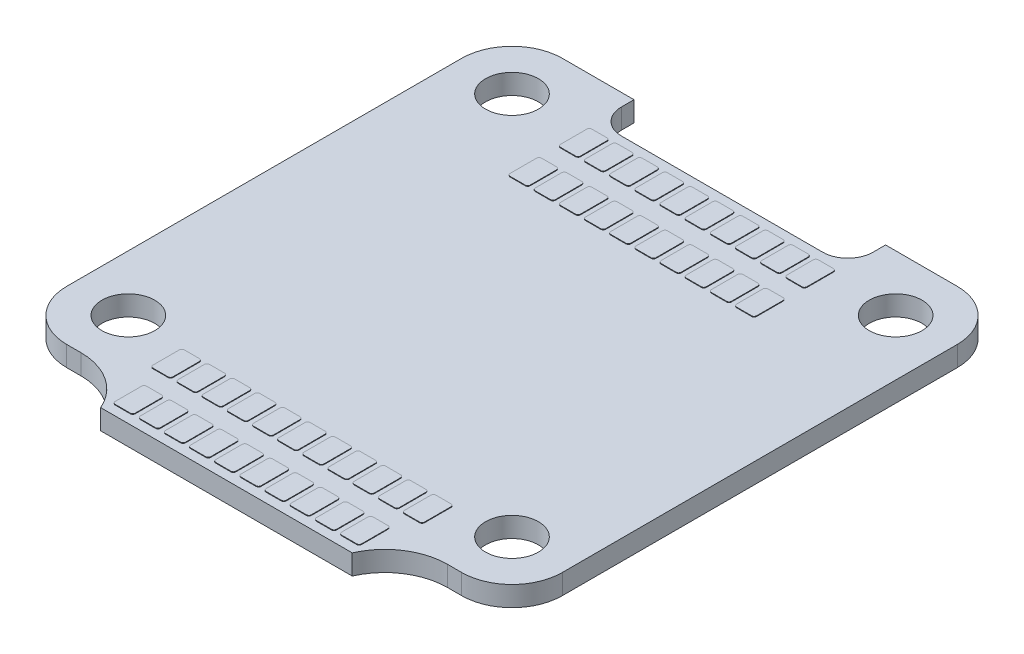
from build123d import *

# Parameters (mm, degrees)
SKETCH1_R           = 2.1
SKETCH1_W           = 20
SKETCH1_H           = 3
BOSS_EXTRUDE1_DEPTH = 0.8
FILLET1_R           = 5
SKETCH2_W           = 1.6
SKETCH2_H           = 2.5
BOSS_EXTRUDE2_DEPTH = 0.05
FILLET2_R           = 0.2


with BuildPart() as part:
    # Sketch1 → Boss-Extrude1 (new, symmetric)
    # profile 1 of 2: a face of its own
    with BuildSketch(Plane(origin=(0, 0, 0), x_dir=(1, 0, 0), z_dir=(0, 1, 0))):
        with BuildLine():
            Line((-10, 18.7), (-10, 19.7))
            Line((-10, 19.7), (-15.7, 19.7))
            ThreePointArc((-15.7, 19.7), (-18.528427125, 18.528427125), (-19.7, 15.7))
            Line((-19.7, 15.7), (-19.7, -15.7))
            ThreePointArc((-19.7, -15.7), (-18.528427125, -18.528427125), (-15.7, -19.7))
            Line((-15.7, -19.7), (-10, -19.7))
            Line((-10, -19.7), (10, -19.7))
            Line((10, -19.7), (15.7, -19.7))
            ThreePointArc((15.7, -19.7), (18.528427125, -18.528427125), (19.7, -15.7))
            Line((19.7, -15.7), (19.7, 15.7))
            ThreePointArc((19.7, 15.7), (18.528427125, 18.528427125), (15.7, 19.7))
            Line((15.7, 19.7), (10, 19.7))
            Line((10, 19.7), (10, 18.7))
            ThreePointArc((10, 18.7), (9.414213562, 17.285786438), (8, 16.7))
            Line((8, 16.7), (-8, 16.7))
            ThreePointArc((-8, 16.7), (-9.414213562, 17.285786438), (-10, 18.7))
        make_face()
        with Locations(Location((-15.25, -15.25, 0), (0, 0, 270))):
            Circle(SKETCH1_R, mode=Mode.SUBTRACT)
        with Locations(Location((15.25, -15.25, 0), (0, 0, 270))):
            Circle(SKETCH1_R, mode=Mode.SUBTRACT)
        with Locations(Location((-15.25, 15.25, 0), (0, 0, 270))):
            Circle(SKETCH1_R, mode=Mode.SUBTRACT)
        with Locations(Location((15.25, 15.25, 0), (0, 0, 270))):
            Circle(SKETCH1_R, mode=Mode.SUBTRACT)
    # profile 2 of 2: a face of its own
    with BuildSketch(Plane(origin=(0, 0, 0), x_dir=(1, 0, 0), z_dir=(0, 1, 0))):
        with Locations((0, -21.2)):
            Rectangle(SKETCH1_W, SKETCH1_H)
    extrude(amount=BOSS_EXTRUDE1_DEPTH, both=True)

    # Fillet1
    # the kernel refuses this fillet: 5 mm, written as the material it adds along each edge
    with BuildSketch(Plane(origin=(-10, -0.8, 19.7), x_dir=(-1, 0, 0), z_dir=(0, 1, 0)), Plane(origin=(10, 0.8, 19.7), x_dir=(1, 0, 0), z_dir=(0, -1, 0))) as fillet1_piece_1:
        with BuildLine():
            CenterArc((4.582575695, 5), FILLET1_R, 203.578178478, 66.421821522)
            Line((0, 3), (-0.091651514, 2.96))
            ThreePointArc((-0.091651514, 2.96), (-0.1, 1.5), (-0.1, 0))
            Line((-0.1, 0), (0, -0.1))
            Line((0, -0.1), (4.582575695, -0.1))
            Line((4.582575695, -0.1), (4.582575695, 0))
        make_face()
    extrude(amount=1.6)

    # Sketch2 → Boss-Extrude2 (add, symmetric)
    with BuildSketch(Plane(origin=(0, 0.8, 0), x_dir=(1, 0, 0), z_dir=(0, 1, 0))):
        with Locations((-3, -20.7)):
            Rectangle(SKETCH2_W, SKETCH2_H)
        with Locations((0, -16.7)):
            Rectangle(SKETCH2_W, SKETCH2_H)
        with Locations((-1, -20.7)):
            Rectangle(SKETCH2_W, SKETCH2_H)
        with Locations((-5, -20.7)):
            Rectangle(SKETCH2_W, SKETCH2_H)
        with Locations((-7, -20.7)):
            Rectangle(SKETCH2_W, SKETCH2_H)
        with Locations((-9, -20.7)):
            Rectangle(SKETCH2_W, SKETCH2_H)
        with Locations((-2, -16.7)):
            Rectangle(SKETCH2_W, SKETCH2_H)
        with Locations((-4, -16.7)):
            Rectangle(SKETCH2_W, SKETCH2_H)
        with Locations((-6, -16.7)):
            Rectangle(SKETCH2_W, SKETCH2_H)
        with Locations((-8, -16.7)):
            Rectangle(SKETCH2_W, SKETCH2_H)
        with Locations((-10, -16.7)):
            Rectangle(SKETCH2_W, SKETCH2_H)
        with Locations((1, -20.7)):
            Rectangle(SKETCH2_W, SKETCH2_H)
        with Locations((10, -16.7)):
            Rectangle(SKETCH2_W, SKETCH2_H)
        with Locations((8, -16.7)):
            Rectangle(SKETCH2_W, SKETCH2_H)
        with Locations((6, -16.7)):
            Rectangle(SKETCH2_W, SKETCH2_H)
        with Locations((4, -16.7)):
            Rectangle(SKETCH2_W, SKETCH2_H)
        with Locations((2, -16.7)):
            Rectangle(SKETCH2_W, SKETCH2_H)
        with Locations((9, -20.7)):
            Rectangle(SKETCH2_W, SKETCH2_H)
        with Locations((7, -20.7)):
            Rectangle(SKETCH2_W, SKETCH2_H)
        with Locations((5, -20.7)):
            Rectangle(SKETCH2_W, SKETCH2_H)
        with Locations((3, -20.7)):
            Rectangle(SKETCH2_W, SKETCH2_H)
        with Locations((3, 14.7)):
            Rectangle(SKETCH2_W, SKETCH2_H)
        with Locations((1, 14.7)):
            Rectangle(SKETCH2_W, SKETCH2_H)
        with Locations((5, 14.7)):
            Rectangle(SKETCH2_W, SKETCH2_H)
        with Locations((7, 14.7)):
            Rectangle(SKETCH2_W, SKETCH2_H)
        with Locations((9, 14.7)):
            Rectangle(SKETCH2_W, SKETCH2_H)
        with Locations((-9, 14.7)):
            Rectangle(SKETCH2_W, SKETCH2_H)
        with Locations((-7, 14.7)):
            Rectangle(SKETCH2_W, SKETCH2_H)
        with Locations((-5, 14.7)):
            Rectangle(SKETCH2_W, SKETCH2_H)
        with Locations((-3, 14.7)):
            Rectangle(SKETCH2_W, SKETCH2_H)
        with Locations((-1, 14.7)):
            Rectangle(SKETCH2_W, SKETCH2_H)
        with Locations((-9, 10.7)):
            Rectangle(SKETCH2_W, SKETCH2_H)
        with Locations((-3, 10.7)):
            Rectangle(SKETCH2_W, SKETCH2_H)
        with Locations((-1, 10.7)):
            Rectangle(SKETCH2_W, SKETCH2_H)
        with Locations((-5, 10.7)):
            Rectangle(SKETCH2_W, SKETCH2_H)
        with Locations((-7, 10.7)):
            Rectangle(SKETCH2_W, SKETCH2_H)
        with Locations((1, 10.7)):
            Rectangle(SKETCH2_W, SKETCH2_H)
        with Locations((9, 10.7)):
            Rectangle(SKETCH2_W, SKETCH2_H)
        with Locations((7, 10.7)):
            Rectangle(SKETCH2_W, SKETCH2_H)
        with Locations((5, 10.7)):
            Rectangle(SKETCH2_W, SKETCH2_H)
        with Locations((3, 10.7)):
            Rectangle(SKETCH2_W, SKETCH2_H)
    extrude(amount=BOSS_EXTRUDE2_DEPTH, both=True)

    # Fillet2
    fillet2_edges = [part.edges().sort_by_distance(p)[0] for p in [
        (-3.8, 0.825, 21.95),
        (-2.2, 0.825, 21.95),
        (-2.2, 0.825, 19.45),
        (-3.8, 0.825, 19.45),
        (-2.8, 0.825, 17.95),
        (-1.2, 0.825, 17.95),
        (-1.2, 0.825, 15.45),
        (-2.8, 0.825, 15.45),
        (-5.8, 0.825, 21.95),
        (-4.2, 0.825, 21.95),
        (-4.2, 0.825, 19.45),
        (-5.8, 0.825, 19.45),
        (-7.8, 0.825, 21.95),
        (-6.2, 0.825, 21.95),
        (-6.2, 0.825, 19.45),
        (-7.8, 0.825, 19.45),
        (-9.8, 0.825, 21.95),
        (-8.2, 0.825, 21.95),
        (-8.2, 0.825, 19.45),
        (-9.8, 0.825, 19.45),
        (1.8, 0.825, 21.95),
        (1.8, 0.825, 19.45),
        (0.2, 0.825, 19.45),
        (0.2, 0.825, 21.95),
        (-4.8, 0.825, 17.95),
        (-3.2, 0.825, 17.95),
        (-3.2, 0.825, 15.45),
        (-4.8, 0.825, 15.45),
        (-6.8, 0.825, 17.95),
        (-5.2, 0.825, 17.95),
        (-5.2, 0.825, 15.45),
        (-6.8, 0.825, 15.45),
        (-8.8, 0.825, 17.95),
        (-7.2, 0.825, 17.95),
        (-7.2, 0.825, 15.45),
        (-8.8, 0.825, 15.45),
        (-10.8, 0.825, 17.95),
        (-9.2, 0.825, 17.95),
        (-9.2, 0.825, 15.45),
        (-10.8, 0.825, 15.45),
        (10.8, 0.825, 17.95),
        (10.8, 0.825, 15.45),
        (9.2, 0.825, 15.45),
        (9.2, 0.825, 17.95),
        (8.8, 0.825, 17.95),
        (8.8, 0.825, 15.45),
        (7.2, 0.825, 15.45),
        (7.2, 0.825, 17.95),
        (6.8, 0.825, 17.95),
        (6.8, 0.825, 15.45),
        (5.2, 0.825, 15.45),
        (5.2, 0.825, 17.95),
        (4.8, 0.825, 17.95),
        (4.8, 0.825, 15.45),
        (3.2, 0.825, 15.45),
        (3.2, 0.825, 17.95),
        (2.8, 0.825, 17.95),
        (2.8, 0.825, 15.45),
        (1.2, 0.825, 15.45),
        (1.2, 0.825, 17.95),
        (9.8, 0.825, 21.95),
        (9.8, 0.825, 19.45),
        (8.2, 0.825, 19.45),
        (8.2, 0.825, 21.95),
        (7.8, 0.825, 21.95),
        (7.8, 0.825, 19.45),
        (6.2, 0.825, 19.45),
        (6.2, 0.825, 21.95),
        (5.8, 0.825, 21.95),
        (5.8, 0.825, 19.45),
        (4.2, 0.825, 19.45),
        (4.2, 0.825, 21.95),
        (3.8, 0.825, 21.95),
        (3.8, 0.825, 19.45),
        (2.2, 0.825, 19.45),
        (2.2, 0.825, 21.95),
        (-1.8, 0.825, -13.45),
        (-0.2, 0.825, -13.45),
        (-0.2, 0.825, -15.95),
        (-1.8, 0.825, -15.95),
        (-2.2, 0.825, -13.45),
        (-2.2, 0.825, -15.95),
        (-3.8, 0.825, -15.95),
        (-3.8, 0.825, -13.45),
        (2.2, 0.825, -13.45),
        (3.8, 0.825, -13.45),
        (3.8, 0.825, -15.95),
        (2.2, 0.825, -15.95),
        (0.2, 0.825, -13.45),
        (1.8, 0.825, -13.45),
        (1.8, 0.825, -15.95),
        (0.2, 0.825, -15.95),
        (4.2, 0.825, -13.45),
        (5.8, 0.825, -13.45),
        (5.8, 0.825, -15.95),
        (4.2, 0.825, -15.95),
        (6.2, 0.825, -13.45),
        (7.8, 0.825, -13.45),
        (7.8, 0.825, -15.95),
        (6.2, 0.825, -15.95),
        (8.2, 0.825, -13.45),
        (9.8, 0.825, -13.45),
        (9.8, 0.825, -15.95),
        (8.2, 0.825, -15.95),
        (-9.8, 0.825, -15.95),
        (-9.8, 0.825, -13.45),
        (-8.2, 0.825, -13.45),
        (-8.2, 0.825, -15.95),
        (-7.8, 0.825, -15.95),
        (-7.8, 0.825, -13.45),
        (-6.2, 0.825, -13.45),
        (-6.2, 0.825, -15.95),
        (-5.8, 0.825, -15.95),
        (-5.8, 0.825, -13.45),
        (-4.2, 0.825, -13.45),
        (-4.2, 0.825, -15.95),
        (-9.8, 0.825, -11.95),
        (-9.8, 0.825, -9.45),
        (-8.2, 0.825, -9.45),
        (-8.2, 0.825, -11.95),
        (-0.2, 0.825, -9.45),
        (-0.2, 0.825, -11.95),
        (-1.8, 0.825, -11.95),
        (-1.8, 0.825, -9.45),
        (-2.2, 0.825, -11.95),
        (-3.8, 0.825, -11.95),
        (-3.8, 0.825, -9.45),
        (-2.2, 0.825, -9.45),
        (-4.2, 0.825, -11.95),
        (-5.8, 0.825, -11.95),
        (-5.8, 0.825, -9.45),
        (-4.2, 0.825, -9.45),
        (-6.2, 0.825, -11.95),
        (-7.8, 0.825, -11.95),
        (-7.8, 0.825, -9.45),
        (-6.2, 0.825, -9.45),
        (1.8, 0.825, -9.45),
        (1.8, 0.825, -11.95),
        (0.2, 0.825, -11.95),
        (0.2, 0.825, -9.45),
        (9.8, 0.825, -9.45),
        (9.8, 0.825, -11.95),
        (8.2, 0.825, -11.95),
        (8.2, 0.825, -9.45),
        (7.8, 0.825, -9.45),
        (7.8, 0.825, -11.95),
        (6.2, 0.825, -11.95),
        (6.2, 0.825, -9.45),
        (5.8, 0.825, -9.45),
        (5.8, 0.825, -11.95),
        (4.2, 0.825, -11.95),
        (4.2, 0.825, -9.45),
        (3.8, 0.825, -9.45),
        (3.8, 0.825, -11.95),
        (2.2, 0.825, -11.95),
        (2.2, 0.825, -9.45),
        (0.8, 0.825, 17.95),
        (0.8, 0.825, 15.45),
        (-0.8, 0.825, 15.45),
        (-0.8, 0.825, 17.95),
        (-0.2, 0.825, 21.95),
        (-0.2, 0.825, 19.45),
        (-1.8, 0.825, 19.45),
        (-1.8, 0.825, 21.95),
    ]]
    fillet(fillet2_edges, radius=FILLET2_R)


solid = part.part
